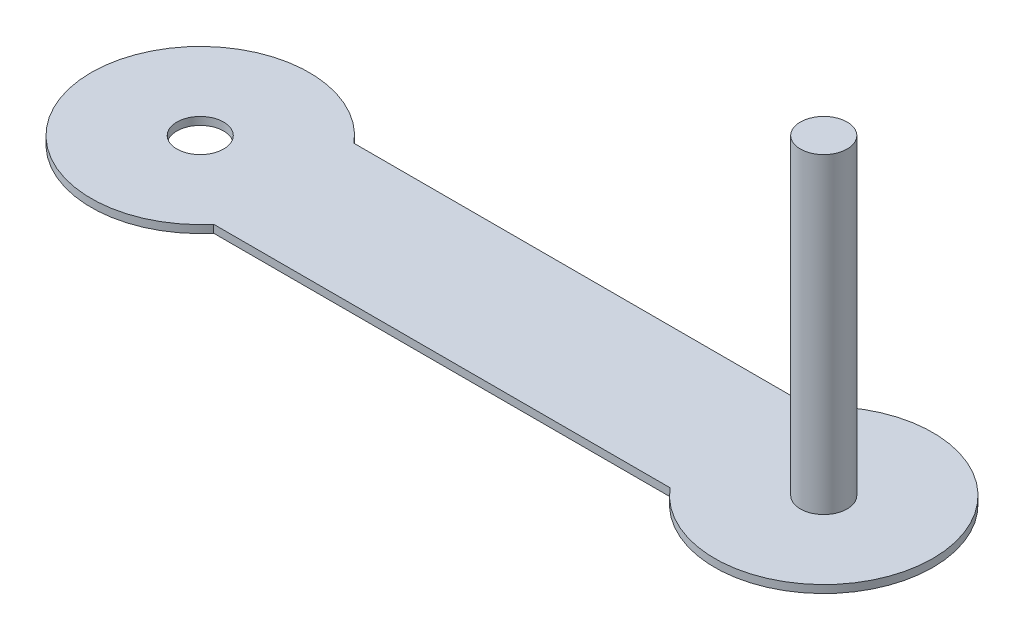
from build123d import *

# Parameters (mm, degrees)
SKETCH1_R           = 9.525
BOSS_EXTRUDE1_DEPTH = 3.175
SKETCH2_R           = 9.525
BOSS_EXTRUDE2_DEPTH = 127


with BuildPart() as part:
    # Sketch1 → Boss-Extrude1 (new body)
    with BuildSketch(Plane(origin=(0, 0, 0), x_dir=(1, 0, 0), z_dir=(0, 1, 0))):
        with BuildLine():
            Line((92.951918189, 28.575), (-92.951918189, 28.575))
            ThreePointArc((-92.951918189, 28.575), (-171.45, 0), (-92.951918189, -28.575))
            Line((-92.951918189, -28.575), (92.951918189, -28.575))
            ThreePointArc((92.951918189, -28.575), (171.45, 0), (92.951918189, 28.575))
        make_face()
        with Locations((-127, 0)):
            Circle(SKETCH1_R, mode=Mode.SUBTRACT)
    extrude(amount=BOSS_EXTRUDE1_DEPTH)

    # Sketch2 → Boss-Extrude2 (add)
    with BuildSketch(Plane(origin=(0, 3.175, 0), x_dir=(1, 0, 0), z_dir=(0, 1, 0))):
        with Locations((127, 0)):
            Circle(SKETCH2_R)
    extrude(amount=BOSS_EXTRUDE2_DEPTH)


solid = part.part
